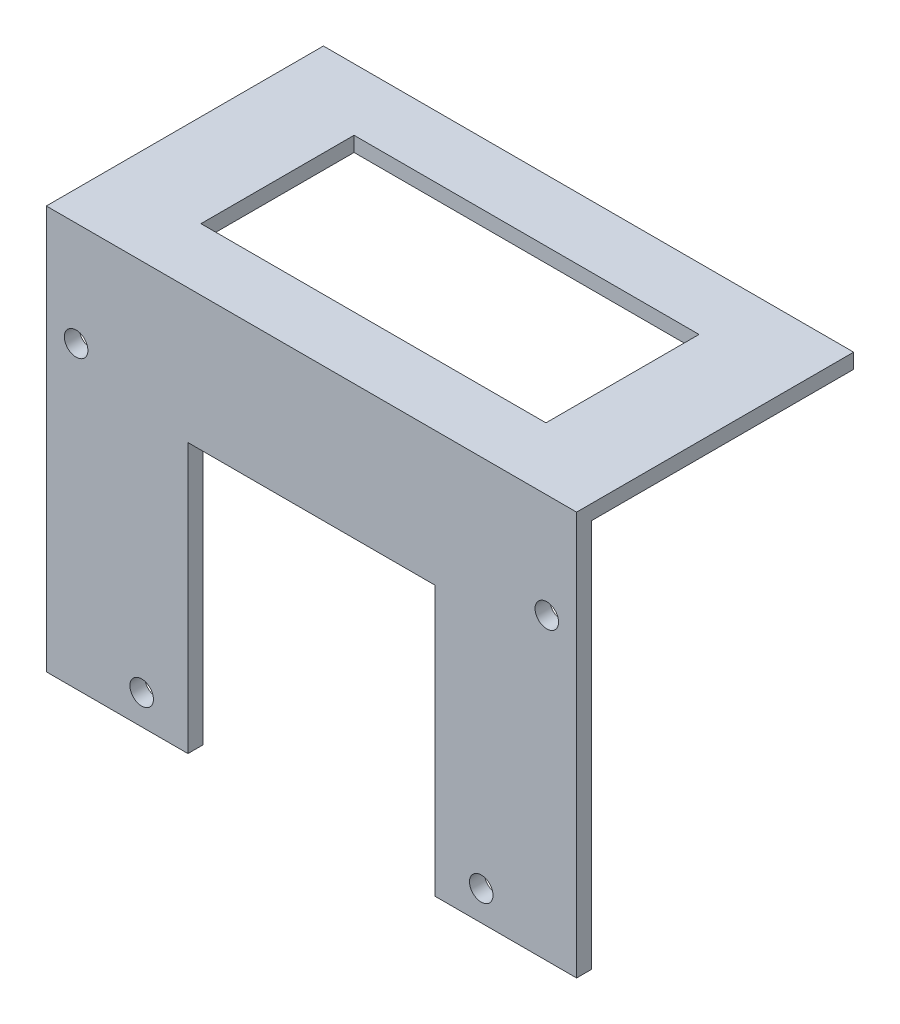
from build123d import *

# Parameters (mm, degrees)
SKETCH1_R           = 2.508000064
BASE_FLANGE1_DEPTH  = 3.175
BOSS_EXTRUDE1_DEPTH = 3.175
SKETCH10_W          = 73.528573301
SKETCH10_H          = 32.63252049
CUT_EXTRUDE1_DEPTH  = 148.382240559


# Sheet-metal steps are written as plain solids
with BuildPart() as part:
    # Sketch1 → Base-Flange1 (new body)
    with BuildSketch(Plane.XY):
        Polygon((-8.910000095, 75.81), (21.268467492, 75.81), (73.931530887, 75.81), (104.109998474, 75.81), (104.109998474, -7.01), (73.931530887, -7.01), (73.931530887, 50.41), (21.268467492, 50.41), (21.268467492, -7.01), (-8.910000095, -7.01), align=None)
        with Locations((-2.560000095, 56.76)):
            Circle(SKETCH1_R, mode=Mode.SUBTRACT)
        with Locations((11.409999905, -0.66)):
            Circle(SKETCH1_R, mode=Mode.SUBTRACT)
        with Locations(Location((83.789998474, -0.66, 0), (0, 0, 180))):
            Circle(SKETCH1_R, mode=Mode.SUBTRACT)
        with Locations(Location((97.759998474, 56.76, 0), (0, 0, 180))):
            Circle(SKETCH1_R, mode=Mode.SUBTRACT)
    extrude(amount=-BASE_FLANGE1_DEPTH)

    # Sketch9 → Boss-Extrude1 (add)
    with BuildSketch(Plane(origin=(0, 75.81, 0), x_dir=(1, 0, 0), z_dir=(0, 1, 0))):
        Polygon((-8.910000095, 3.175), (-8.910000095, 59.055), (104.109998474, 59.055), (104.109998474, 0), (-8.910000095, 0), align=None)
    extrude(amount=BOSS_EXTRUDE1_DEPTH)

    # Sketch10 → Cut-Extrude1 (cut, through all)
    with BuildSketch(Plane(origin=(0, 78.985, 0), x_dir=(1, 0, 0), z_dir=(0, 1, 0))):
        with Locations((47.59999919, 29.5275)):
            Rectangle(SKETCH10_W, SKETCH10_H)
    extrude(amount=-CUT_EXTRUDE1_DEPTH, mode=Mode.SUBTRACT)


solid = part.part
